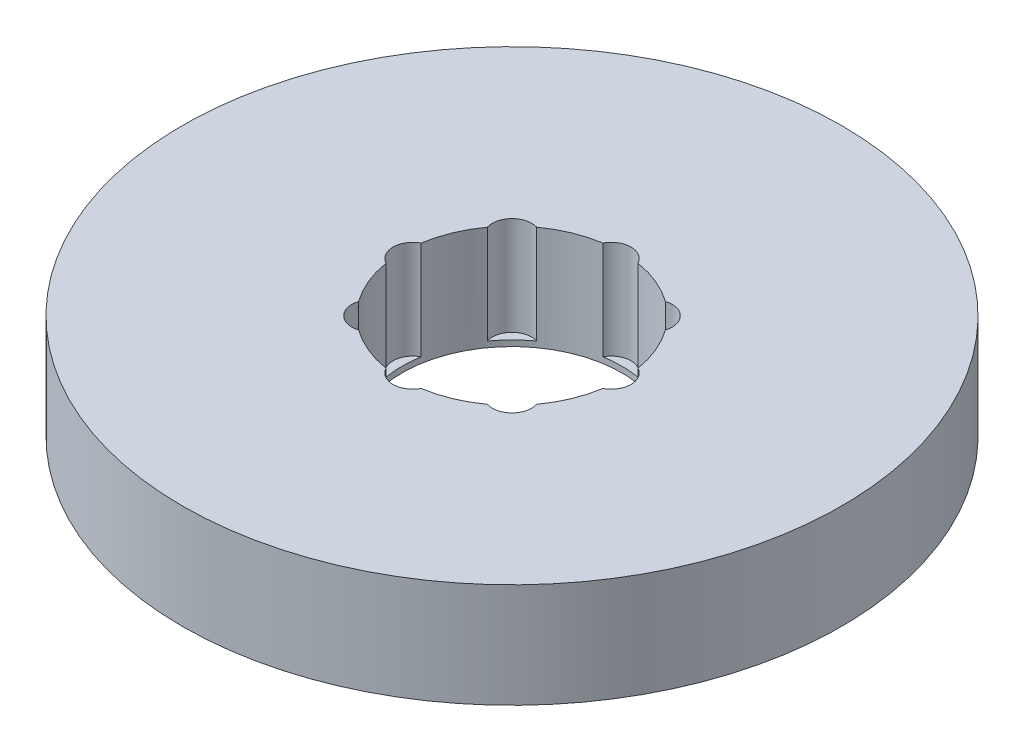
from build123d import *

# Parameters (mm, degrees)
SKETCH1_R           = 60
BOSS_EXTRUDE1_DEPTH = 19
SKETCH2_R           = 20
CUT_EXTRUDE1_DEPTH  = 87.954010833
SKETCH3_R           = 3.600463663
CUT_EXTRUDE2_DEPTH  = 17.937415857
CIRPATTERN1_COUNT   = 8


with BuildPart() as part:
    # Sketch1 → Boss-Extrude1 (new body)
    with BuildSketch(Plane(origin=(0, 0, 0), x_dir=(1, 0, 0), z_dir=(0, 1, 0))):
        Circle(SKETCH1_R)
    extrude(amount=BOSS_EXTRUDE1_DEPTH)

    # Sketch2 → Cut-Extrude1 (cut, through all)
    with BuildSketch(Plane(origin=(0, 0, 0), x_dir=(1, 0, 0), z_dir=(0, 1, 0))):
        Circle(SKETCH2_R)
    extrude(amount=CUT_EXTRUDE1_DEPTH, mode=Mode.SUBTRACT)

    # Sketch3 → Cut-Extrude2 (cut)
    with BuildSketch(Plane(origin=(0, 19, 0), x_dir=(1, 0, 0), z_dir=(0, 1, 0))):
        with Locations((-18.065605944, 0)):
            Circle(SKETCH3_R)
    cut_extrude2 = extrude(amount=-CUT_EXTRUDE2_DEPTH, mode=Mode.SUBTRACT)

    # CirPattern1: Cut-Extrude2 ×8 about axis
    cirpattern1_axis = Axis((0, 0, 0), (0, 1, 0))
    for i in range(1, CIRPATTERN1_COUNT):
        add(cut_extrude2.rotate(cirpattern1_axis, i * 360 / CIRPATTERN1_COUNT), mode=Mode.SUBTRACT)


solid = part.part
